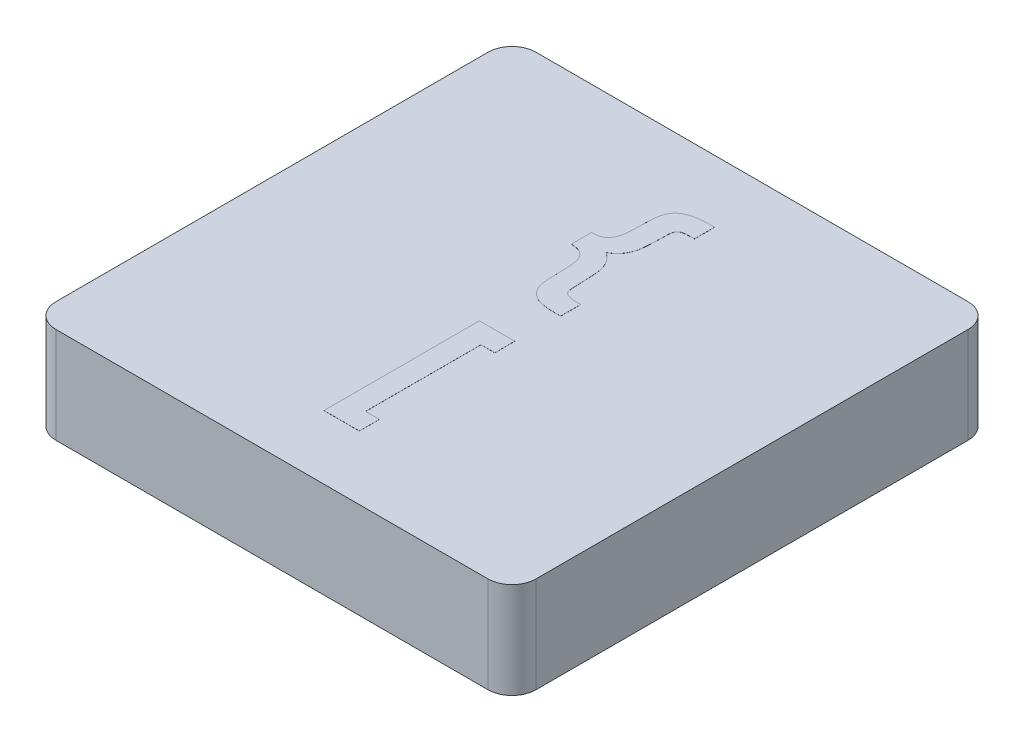
from build123d import *

# Parameters (mm, degrees)
SKETCH1_W           = 12.7
SKETCH1_H           = 12.7
BOSS_EXTRUDE1_DEPTH = 2.54
FILLET1_R           = 0.635
SHELL1_START        = 0.635
SHELL1_OUTLINE_W    = 1.905
SHELL1_OUTLINE_H    = 11.43
SHELL1_DEPTH        = 11.43
SKETCH2_R           = 2.54
BOSS_EXTRUDE2_DEPTH = 1.905
BOSS_EXTRUDE4_DEPTH = 0.00254


# Read off the part's stored shape, not the designer's step: Shell1
with BuildPart() as part:
    # Sketch1 → Boss-Extrude1 (new body)
    with BuildSketch(Plane(origin=(0, 0, 0), x_dir=(1, 0, 0), z_dir=(0, 1, 0))):
        with Locations((6.35, 6.35)):
            Rectangle(SKETCH1_W, SKETCH1_H)
    extrude(amount=BOSS_EXTRUDE1_DEPTH)

    # Fillet1
    fillet1_edges = [part.edges().sort_by_distance(p)[0] for p in [
        (0, 1.27, -12.7),
        (12.7, 1.27, -12.7),
        (12.7, 1.27, 0),
        (0, 1.27, 0),
    ]]
    fillet(fillet1_edges, radius=FILLET1_R)

    # Shell1 outline → Shell1 (cut)
    with BuildSketch(Plane.YZ.offset(SHELL1_START)):
        with Locations((0.9525, -6.35)):
            Rectangle(SHELL1_OUTLINE_W, SHELL1_OUTLINE_H)
    extrude(amount=SHELL1_DEPTH, mode=Mode.SUBTRACT)

    # Sketch2 → Boss-Extrude2 (add)
    with BuildSketch(Plane(origin=(0, 1.905, 0), x_dir=(-1, 0, 0), z_dir=(0, -1, 0))):
        with Locations(Location((-6.35, 6.35, 0), (0, 0, 270))):
            Circle(SKETCH2_R)
    extrude(amount=BOSS_EXTRUDE2_DEPTH)

    # Sketch4 → Boss-Extrude4 (add)
    with BuildSketch(Plane(origin=(0, 2.54, 0), x_dir=(1, 0, 0), z_dir=(0, 1, 0))):
        Polygon((6.040641026, 5.796410256), (6.976858974, 5.796410256), (6.976858974, 5.26724359), (6.610512821, 5.26724359), (6.610512821, 2.214358974), (6.976858974, 2.214358974), (6.976858974, 1.685192308), (6.040641026, 1.685192308), align=None)
        with BuildLine():
            Line((5.501705128, 8.769512821), (5.501705128, 9.298679487))
            add(Edge.make_bspline(
                [(5.501705128, 9.298679487), (5.532724551, 9.300577954), (5.590656774, 9.304123553), (5.670981575, 9.318580211), (5.738741024, 9.339627117), (5.795240216, 9.368692195), (5.841347316, 9.407649179), (5.880872771, 9.454311284), (5.914137334, 9.51039725), (5.937186765, 9.563561565), (5.953049789, 9.612405831), (5.963005648, 9.655837142), (5.971085115, 9.705154512), (5.97787015, 9.760121424), (5.983848589, 9.821176644), (5.987184914, 9.888028776), (5.990050912, 9.960961441), (5.990127023, 10.011439709), (5.990166667, 10.037731971)],
                knots=[0, 0, 0, 0, 1.451517752, 2.710870899, 3.804446884, 4.757414975, 5.658161607, 6.607155001, 7.602945962, 8.694545061, 9.30871163, 10.000889012, 10.774639975, 11.643541707, 12.589063004, 13.641044214, 14.771307238, 16, 16, 16, 16], degree=3))
            add(Edge.make_bspline(
                [(5.990166667, 10.037731971), (5.99027291, 10.070806168), (5.990475881, 10.133992465), (5.992430984, 10.224740262), (5.995391945, 10.307239275), (6.000125578, 10.381629312), (6.004576412, 10.448111322), (6.011928876, 10.506142904), (6.018937818, 10.556415186), (6.031654225, 10.611230568), (6.050499963, 10.67120317), (6.079363112, 10.735660672), (6.113646688, 10.792741786), (6.154613928, 10.843272465), (6.204455745, 10.88728976), (6.263366728, 10.926601221), (6.332418843, 10.96169463), (6.396939353, 10.986683085), (6.454324586, 11.005661541), (6.50346794, 11.016391589), (6.556837627, 11.026835102), (6.61501627, 11.034947693), (6.677817883, 11.041279814), (6.745295804, 11.045379799), (6.817163158, 11.049034753), (6.866593581, 11.04901181), (6.892039663, 11.049)],
                knots=[0, 0, 0, 0, 1.46534077, 2.799446828, 4.021441889, 5.122390044, 6.102149716, 6.972462297, 7.7137374, 8.349485774, 9.463459583, 10.49348432, 11.471305969, 12.40580496, 13.363708508, 14.405783216, 15.535837735, 16.788212615, 17.468477195, 18.211238595, 19.014437677, 19.877880266, 20.812520865, 21.810349341, 22.872798814, 24, 24, 24, 24], degree=3))
            Line((6.892039663, 11.049), (7.007794872, 11.049))
            Line((7.007794872, 11.049), (7.007794872, 10.519833333))
            add(Edge.make_bspline(
                [(7.007794872, 10.519833333), (6.989139417, 10.519587027), (6.953312265, 10.519114005), (6.902192532, 10.51898063), (6.856196849, 10.516761047), (6.815211942, 10.514648161), (6.779444801, 10.510463786), (6.748361679, 10.507065532), (6.722625011, 10.502147344), (6.69568576, 10.49451003), (6.667022453, 10.483581701), (6.637681703, 10.465672367), (6.612925486, 10.444240108), (6.591660898, 10.418455284), (6.577004821, 10.383512508), (6.566766404, 10.339311488), (6.560706101, 10.283818342), (6.560274859, 10.243181314), (6.560038462, 10.220905048)],
                knots=[0, 0, 0, 0, 1.386539278, 2.662800514, 3.798152769, 4.808447339, 5.711450255, 6.473580847, 7.131722202, 7.655446357, 8.553625873, 9.402064563, 10.195002251, 10.979916755, 11.86135854, 12.980969535, 14.34503827, 16, 16, 16, 16], degree=3))
            add(Edge.make_bspline(
                [(6.560038462, 10.220905048), (6.559545706, 10.176381457), (6.558534177, 10.084983372), (6.554177156, 9.943947845), (6.545761586, 9.795526586), (6.537956266, 9.694057712), (6.533961739, 9.642129006)],
                knots=[0, 0, 0, 0, 0.92200247, 1.892687869, 2.921541302, 4, 4, 4, 4], degree=3))
            add(Edge.make_bspline(
                [(6.533961739, 9.642129006), (6.530117819, 9.608277323), (6.522539172, 9.541535565), (6.497126743, 9.445069771), (6.461748345, 9.353690497), (6.429734003, 9.297479672), (6.413754407, 9.269422676)],
                knots=[0, 0, 0, 0, 1.03352617, 2.037693405, 3.020536894, 4, 4, 4, 4], degree=3))
            add(Edge.make_bspline(
                [(6.413754407, 9.269422676), (6.399275564, 9.248804803), (6.368653828, 9.205199448), (6.307860152, 9.146179587), (6.235183983, 9.086222662), (6.179303029, 9.050855916), (6.149807091, 9.032188101)],
                knots=[0, 0, 0, 0, 0.843495541, 1.78393383, 2.830282145, 4, 4, 4, 4], degree=3))
            add(Edge.make_bspline(
                [(6.149807091, 9.032188101), (6.173049633, 9.016766999), (6.218724746, 8.986462199), (6.280720945, 8.933109752), (6.333920011, 8.872989352), (6.380789418, 8.807176718), (6.419813309, 8.733359395), (6.452416847, 8.6512131), (6.476240614, 8.55922335), (6.486596694, 8.49464301), (6.491984575, 8.461044271)],
                knots=[0, 0, 0, 0, 0.968830733, 1.903899033, 2.832763283, 3.752700456, 4.705369692, 5.727457187, 6.817680861, 8, 8, 8, 8], degree=3))
            add(Edge.make_bspline(
                [(6.491984575, 8.461044271), (6.493146133, 8.451300636), (6.495967556, 8.427633362), (6.497777051, 8.385555815), (6.50116022, 8.330878989), (6.505264993, 8.263278599), (6.507854941, 8.182882253), (6.512052118, 8.089623889), (6.515713081, 7.98361332), (6.518082021, 7.908557532), (6.519333333, 7.868911859)],
                knots=[0, 0, 0, 0, 0.397118983, 0.964601375, 1.703940229, 2.615138326, 3.70595647, 4.960054814, 6.394252129, 8, 8, 8, 8], degree=3))
            add(Edge.make_bspline(
                [(6.519333333, 7.868911859), (6.520579054, 7.841114333), (6.522806566, 7.791408715), (6.528797656, 7.725746662), (6.534024869, 7.676794658), (6.54216353, 7.65090783), (6.545410056, 7.64058153)],
                knots=[0, 0, 0, 0, 1.448250494, 2.589661623, 3.437413606, 4, 4, 4, 4], degree=3))
            add(Edge.make_bspline(
                [(6.545410056, 7.64058153), (6.551354746, 7.630113272), (6.56339075, 7.608918561), (6.589875696, 7.581725399), (6.622903191, 7.55908913), (6.655245791, 7.542548203), (6.686799456, 7.533078155), (6.716248693, 7.52590647), (6.751399708, 7.520618856), (6.7918716, 7.515397976), (6.837928889, 7.51173648), (6.88946915, 7.509224277), (6.946733128, 7.508161361), (6.986806182, 7.507828294), (7.007794872, 7.507653846)],
                knots=[0, 0, 0, 0, 0.854656799, 1.730393381, 2.672957062, 3.699349592, 4.301036757, 5.015168751, 5.856653451, 6.830503664, 7.921393134, 9.14589491, 10.505131993, 12, 12, 12, 12], degree=3))
            Line((7.007794872, 7.507653846), (7.007794872, 6.978487179))
            Line((7.007794872, 6.978487179), (6.892039663, 6.978487179))
            add(Edge.make_bspline(
                [(6.892039663, 6.978487179), (6.866383077, 6.978526215), (6.816963917, 6.978601404), (6.745307814, 6.981504501), (6.678867696, 6.984758361), (6.61746922, 6.991144216), (6.561045697, 6.996538747), (6.50982297, 7.005993345), (6.463681374, 7.015763286), (6.409658587, 7.030867229), (6.349044044, 7.054494053), (6.282121034, 7.08767088), (6.223475812, 7.128634915), (6.170084284, 7.173473086), (6.125792724, 7.226665597), (6.086748214, 7.284923434), (6.056128199, 7.350373385), (6.035010547, 7.409747118), (6.021564816, 7.462998966), (6.01394496, 7.510317213), (6.005784949, 7.563862295), (6.000793847, 7.624440305), (5.995228131, 7.691595022), (5.992493569, 7.765435518), (5.990466407, 7.845791113), (5.990269319, 7.901558967), (5.990166667, 7.930605569)],
                knots=[0, 0, 0, 0, 1.180076656, 2.27303809, 3.298707054, 4.239039526, 5.112461827, 5.904507711, 6.633329935, 7.281697308, 8.48250633, 9.620862782, 10.708284457, 11.766090354, 12.817538401, 13.88054636, 14.984116166, 16.131501886, 16.774862487, 17.507589143, 18.335104889, 19.265728017, 20.302418806, 21.434743744, 22.663890185, 24, 24, 24, 24], degree=3))
            add(Edge.make_bspline(
                [(5.990166667, 7.930605569), (5.990037977, 7.963042723), (5.989792348, 8.02495516), (5.988132762, 8.113818002), (5.98420043, 8.194387809), (5.979333537, 8.266723087), (5.972920121, 8.330771786), (5.965735187, 8.386687047), (5.95627693, 8.434472879), (5.942293856, 8.486214809), (5.920195452, 8.541572567), (5.888317363, 8.600377736), (5.848148398, 8.649211105), (5.801607935, 8.690417629), (5.744582017, 8.723334024), (5.67496369, 8.746517187), (5.592703317, 8.763035254), (5.533381357, 8.767257997), (5.501705128, 8.769512821)],
                knots=[0, 0, 0, 0, 1.386030809, 2.645501613, 3.797256415, 4.832502903, 5.742904192, 6.547458989, 7.240326361, 7.822704252, 8.835390849, 9.780379381, 10.668884048, 11.522772015, 12.423932252, 13.461079439, 14.644289055, 16, 16, 16, 16], degree=3))
        make_face()
    extrude(amount=BOSS_EXTRUDE4_DEPTH)


solid = part.part
